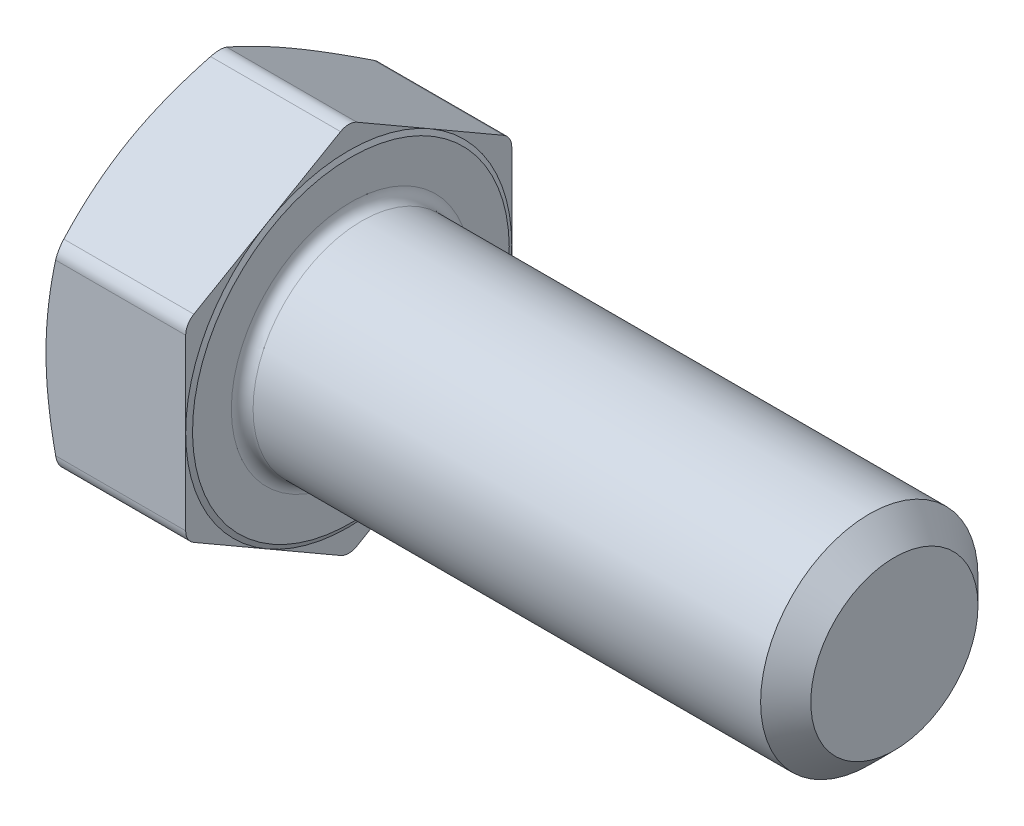
from build123d import *

# Parameters (mm, degrees)
SKETCH2_R                = 6.35
BOSS_EXTRUDE1_DEPTH      = 31.75
BOSS_EXTRUDE2_DEPTH      = 8.73125
SKETCH5_OUTSIDE_W        = 68.47
SKETCH5_OUTSIDE_H        = 71.418
SKETCH5_OUTSIDE_R        = 8.5725
CUT_EXTRUDE1_DEPTH       = 8.73125
CUT_EXTRUDE1_DRAFT       = -65
BOSS_EXTRUDE5_DEPTH      = 0.0635
FILLET5_R                = 0.0635
CIRPATTERN1_COUNT        = 6
FILLET5_OF_CIRPATTERN1_R = 0.0635
FILLET7_R                = 0.9525
CHAMFER1_SIZE            = 1.465384615
FILLET4_R                = 0.635


with BuildPart() as part:
    # Sketch2 → Boss-Extrude1 (new body)
    with BuildSketch(Plane(origin=(0, 0, 0), x_dir=(0, 0, -1), z_dir=(1, 0, 0))):
        Circle(SKETCH2_R)
    extrude(amount=BOSS_EXTRUDE1_DEPTH)

    # Sketch3 → Boss-Extrude2 (add)
    with BuildSketch(Plane.ZY):
        Polygon((0, 10.998522628), (-9.525, 5.499261314), (-9.525, -5.499261314), (0, -10.998522628), (9.525, -5.499261314), (9.525, 5.499261314), align=None)
    extrude(amount=BOSS_EXTRUDE2_DEPTH)


with BuildPart() as cut_extrude1_tool:
    # Sketch5 outside → Cut-Extrude1 (with draft: the straight prism first)
    with BuildSketch(Plane.ZY.offset(8.73125)):
        Rectangle(SKETCH5_OUTSIDE_W, SKETCH5_OUTSIDE_H)
        Circle(SKETCH5_OUTSIDE_R, mode=Mode.SUBTRACT)
    extrude(amount=-CUT_EXTRUDE1_DEPTH)
    # Cut-Extrude1: the draft: its side faces are tilted about the plane it starts from
    cut_extrude1_sides = [cut_extrude1_tool.faces().sort_by_distance(p)[0] for p in [
        (-4.365625, -35.709, 0),
        (-4.365625, 0, 34.235),
        (-4.365625, 35.709, 0),
        (-4.365625, 0, -34.235),
        (-4.365625, 0, -8.5725),
    ]]
    draft(cut_extrude1_sides, Plane.ZY.offset(8.73125), CUT_EXTRUDE1_DRAFT)


with BuildPart() as part_1:
    add(part.part)

    # Cut-Extrude1: cut by cut_extrude1_tool
    add(cut_extrude1_tool.part, mode=Mode.SUBTRACT)

    # Sketch11 → Boss-Extrude5 (add)
    with BuildSketch(Plane.ZY.offset(8.73125)):
        with BuildLine():
            Line((0.381, 6.76275), (0.381, 4.191))
            ThreePointArc((0.381, 4.191), (0, 3.81), (-0.381, 4.191))
            Line((-0.381, 4.191), (-0.381, 6.76275))
            ThreePointArc((-0.381, 6.76275), (0, 7.14375), (0.381, 6.76275))
        make_face()
    boss_extrude5 = extrude(amount=BOSS_EXTRUDE5_DEPTH)

    # Fillet5
    fillet5_edges = [part_1.edges().sort_by_distance(p)[0] for p in [
        (-8.79475, 5.476875, 0.381),
        (-8.79475, 3.81, 0),
        (-8.79475, 5.476875, -0.381),
        (-8.79475, 7.14375, 0),
    ]]
    fillet(fillet5_edges, radius=FILLET5_R - 0.0001)  # a hair under: the kernel refuses the full size

    # CirPattern1: Boss-Extrude5 ×6 about axis
    cirpattern1_axis = Axis((0, 0, 0), (1, 0, 0))
    for i in range(1, CIRPATTERN1_COUNT):
        add(boss_extrude5.rotate(cirpattern1_axis, i * 360 / CIRPATTERN1_COUNT))

    # Fillet5 of CirPattern1
    fillet5_of_cirpattern1_edges = [part_1.edges().sort_by_distance(p)[0] for p in [
        (-8.79475, 2.408481821, 4.933612883),
        (-8.79475, 1.905, 3.299556788),
        (-8.79475, 3.068393179, 4.552612883),
        (-8.79475, 3.571875, 6.186668978),
        (-8.79475, -3.068393179, 4.552612883),
        (-8.79475, -1.905, 3.299556788),
        (-8.79475, -2.408481821, 4.933612883),
        (-8.79475, -3.571875, 6.186668978),
        (-8.79475, -5.476875, -0.381),
        (-8.79475, -3.81, 0),
        (-8.79475, -5.476875, 0.381),
        (-8.79475, -7.14375, 0),
        (-8.79475, -2.408481821, -4.933612883),
        (-8.79475, -1.905, -3.299556788),
        (-8.79475, -3.068393179, -4.552612883),
        (-8.79475, -3.571875, -6.186668978),
        (-8.79475, 3.068393179, -4.552612883),
        (-8.79475, 1.905, -3.299556788),
        (-8.79475, 2.408481821, -4.933612883),
        (-8.79475, 3.571875, -6.186668978),
    ]]
    fillet(fillet5_of_cirpattern1_edges, radius=FILLET5_OF_CIRPATTERN1_R - 0.0001)  # a hair under: the kernel refuses the full size

    # Fillet7
    fillet7_edges = [part_1.edges().sort_by_distance(p)[0] for p in [
        (-3.799988535, -10.998522628, 0),
        (-3.799988535, -5.499261314, -9.525),
        (-3.799988535, 5.499261314, -9.525),
        (-3.799988535, 10.998522628, 0),
        (-3.799988535, -5.499261314, 9.525),
        (-3.799988535, 5.499261314, 9.525),
    ]]
    fillet(fillet7_edges, radius=FILLET7_R)

    # Chamfer1
    chamfer1_edges = [part_1.edges().sort_by_distance(p)[0] for p in [
        (31.75, 0, 6.35),
    ]]
    chamfer(chamfer1_edges, length=CHAMFER1_SIZE)

    # Sketch15 → Cut-Revolve1 (revolve, cut)
    with BuildSketch(Plane.XY, mode=Mode.PRIVATE) as cut_revolve1_sk:
        Polygon((0, 9.252647621), (-0.127, 9.525), (-0.127, 10.998522628), (0, 10.998522628), align=None)
    revolve(cut_revolve1_sk.sketch.rotate(Axis((0, 0, 0), (-1, 0, 0)), 210), axis=Axis((0, 0, 0), (-1, 0, 0)), mode=Mode.SUBTRACT)

    # Fillet4
    fillet4_edges = [part_1.edges().sort_by_distance(p)[0] for p in [
        (0, 0, 6.35),
    ]]
    fillet(fillet4_edges, radius=FILLET4_R)


solid = part_1.part
